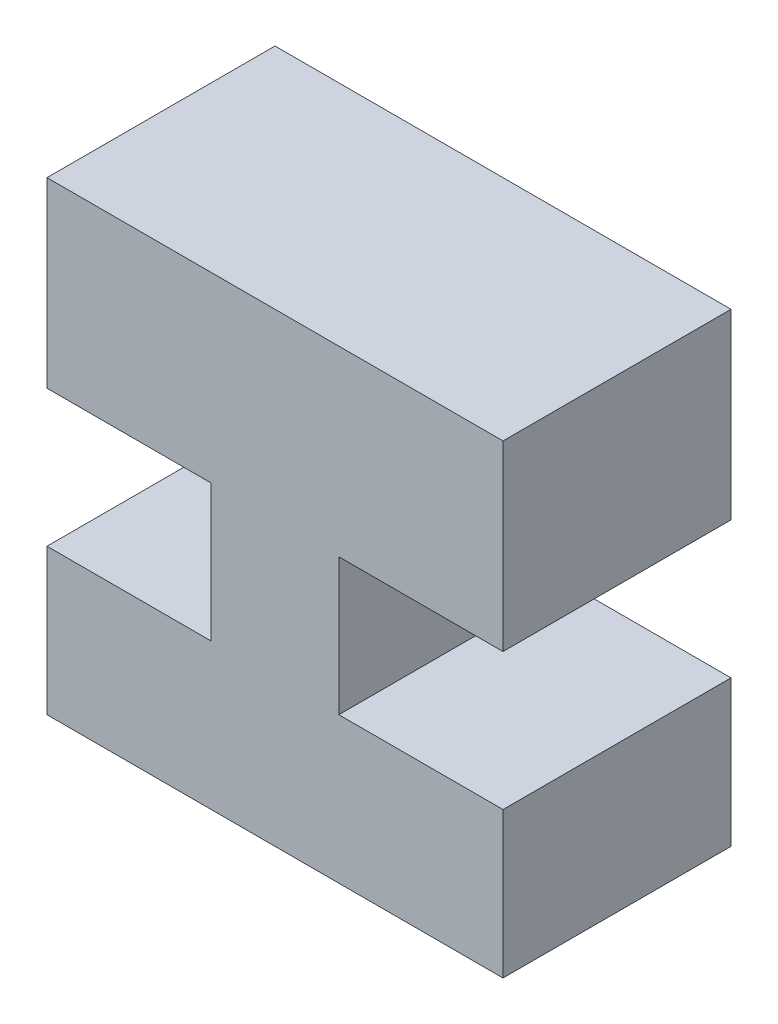
from build123d import *

# Parameters (mm, degrees)
BODY_DEPTH = 6.35
SKETCH4_R  = 1.27
FLAG_DEPTH = 0.254
HOLDER_R   = 2.54


with BuildPart() as part:
    # Sketch2 → body (new body)
    with BuildSketch(Plane.XY):
        Polygon((0, 0), (12.7, 0), (12.7, -5.08), (8.128, -5.08), (8.128, -8.89), (12.7, -8.89), (12.7, -12.954), (0, -12.954), (0, -8.89), (4.572, -8.89), (4.572, -5.08), (0, -5.08), align=None)
    extrude(amount=BODY_DEPTH)

    # Sketch4 → flag (add)
    with BuildSketch(Plane.XZ.offset(12.954)):
        with Locations(Location((6.35, 3.175, 0), (0, 0, 90))):
            Circle(SKETCH4_R)
    extrude(amount=FLAG_DEPTH)

    # holder
    # the kernel refuses this fillet: 2.54 mm, written as the material it adds along each edge
    with BuildSketch(Plane(origin=(6.35, -12.954, 3.175), x_dir=(0, 0, 1), z_dir=(1, 0, 0))) as holder_piece_1:
        with BuildLine():
            CenterArc((2.377160332, 2.54), HOLDER_R, 244.158067237, 25.841932763)
            Line((1.27, 0.254), (1.27, 0))
            Line((1.27, 0), (2.377160332, 0))
        make_face()
    revolve(axis=Axis((6.35, -12.954, 3.175), (0, -1, 0)))


solid = part.part
